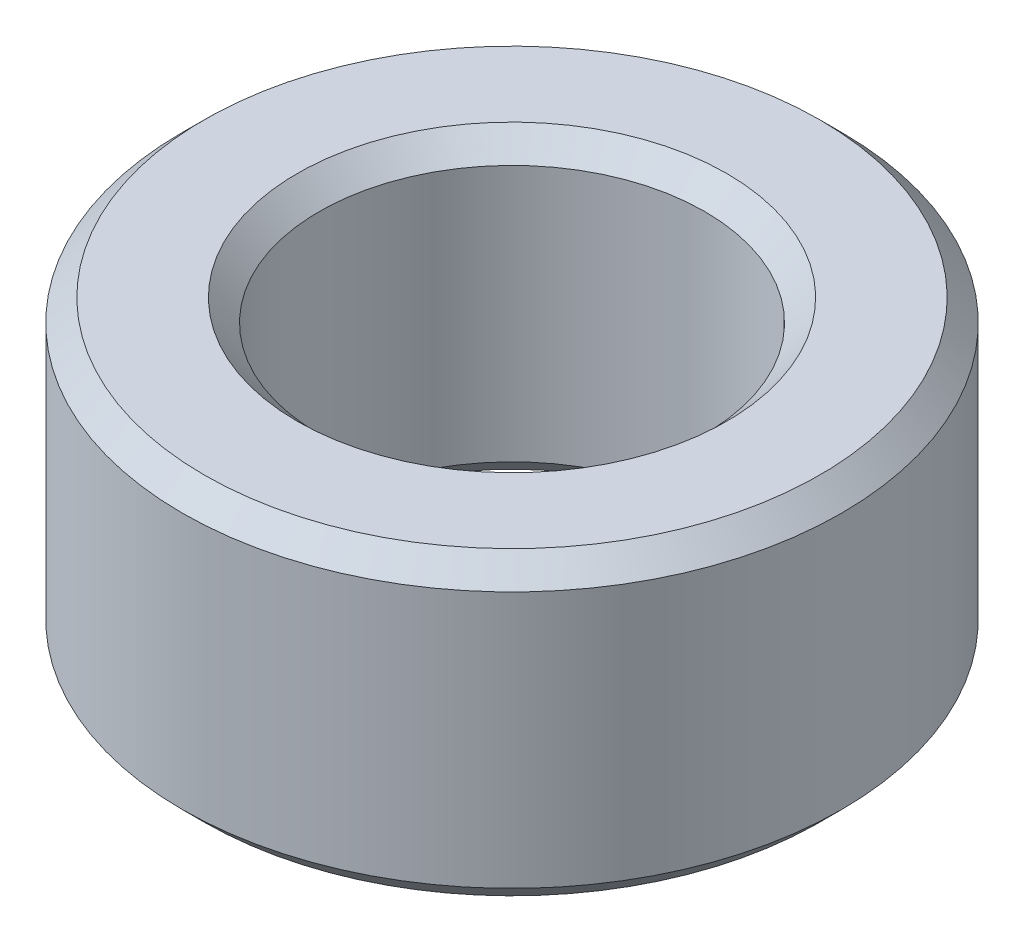
from build123d import *

# Parameters (mm, degrees)
SKETCH1_R           = 30
BOSS_EXTRUDE1_DEPTH = 27.359227131
SKETCH2_R           = 17.537005843
CUT_EXTRUDE1_DEPTH  = 51.482940774
CHAMFER1_SIZE       = 2.000021913


with BuildPart() as part:
    # Sketch1 → Boss-Extrude1 (new body)
    with BuildSketch(Plane(origin=(0, 0, 0), x_dir=(1, 0, 0), z_dir=(0, 1, 0))):
        Circle(SKETCH1_R)
    extrude(amount=BOSS_EXTRUDE1_DEPTH)

    # Sketch2 → Cut-Extrude1 (cut, through all)
    with BuildSketch(Plane(origin=(0, 0, 0), x_dir=(1, 0, 0), z_dir=(0, 1, 0))):
        Circle(SKETCH2_R)
    extrude(amount=CUT_EXTRUDE1_DEPTH, mode=Mode.SUBTRACT)

    # Chamfer1
    chamfer1_edges = [part.edges().sort_by_distance(p)[0] for p in [
        (-17.537005843, 27.359227131, 0),
        (-17.537005843, 0, 0),
        (-30, 0, 0),
        (-30, 27.359227131, 0),
    ]]
    chamfer(chamfer1_edges, length=CHAMFER1_SIZE)


solid = part.part
